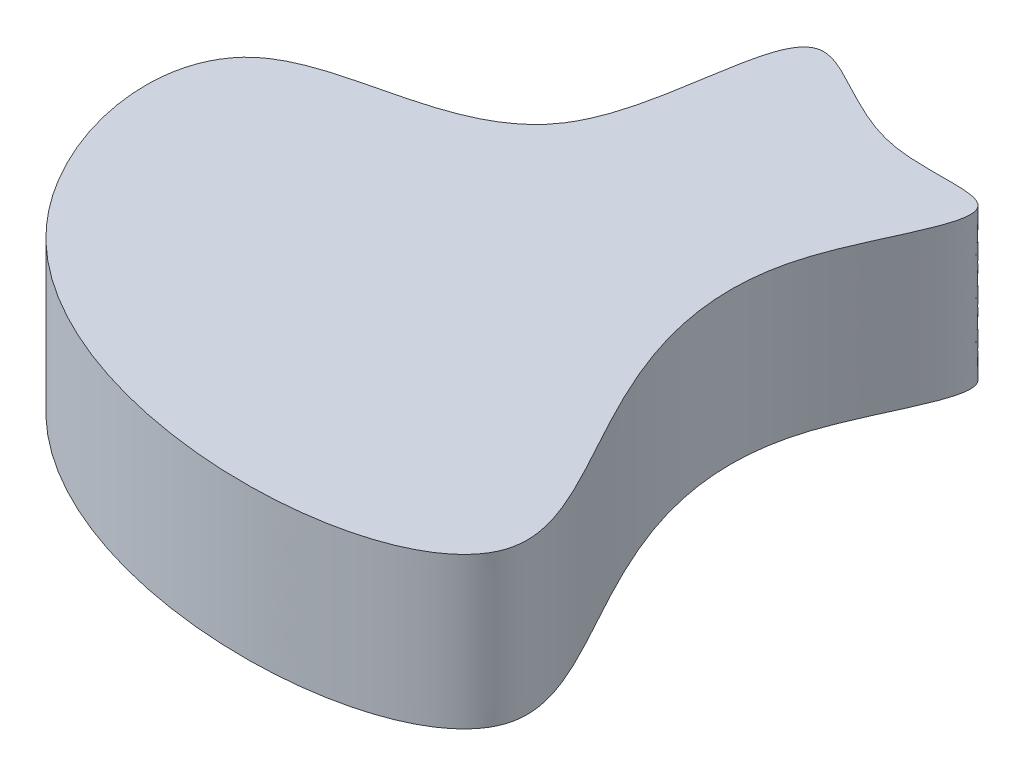
from build123d import *

# Parameters (mm, degrees)
SHEET_START           = -10
SHEET_EXTRUDE_3_DEPTH = 20


# Read off the part's stored shape, not the designer's step: Поверхность-Вытянуть3
with BuildPart() as part:
    # Sheet Extrude 3 outline → Sheet Extrude 3 (new body)
    with BuildSketch(Plane(origin=(0, 0, 0), x_dir=(1, 0, 0), z_dir=(0, 1, 0)).offset(SHEET_START)):
        with BuildLine():
            add(Edge.make_bspline(
                [(-49.150797062, 113.553148676), (-55.24396238, 104.254853534), (-87.674306087, 108.685326321), (-74.090342795, 45.482384795), (27.835423646, 48.507037029), (-32.440288994, 97.91368587), (-5.834804804, 134.922849357), (-27.497348782, 130.100372673), (-46.771108531, 147.964305176), (-43.952599031, 121.485705397), (-49.150797062, 113.553148676)],
                knots=[0, 0, 0, 0, 0.11935861, 0.247934811, 0.506564168, 0.7135423, 0.785581698, 0.834101116, 0.898172844, 1, 1, 1, 1], degree=3))
        make_face()
    extrude(amount=SHEET_EXTRUDE_3_DEPTH)


solid = part.part
